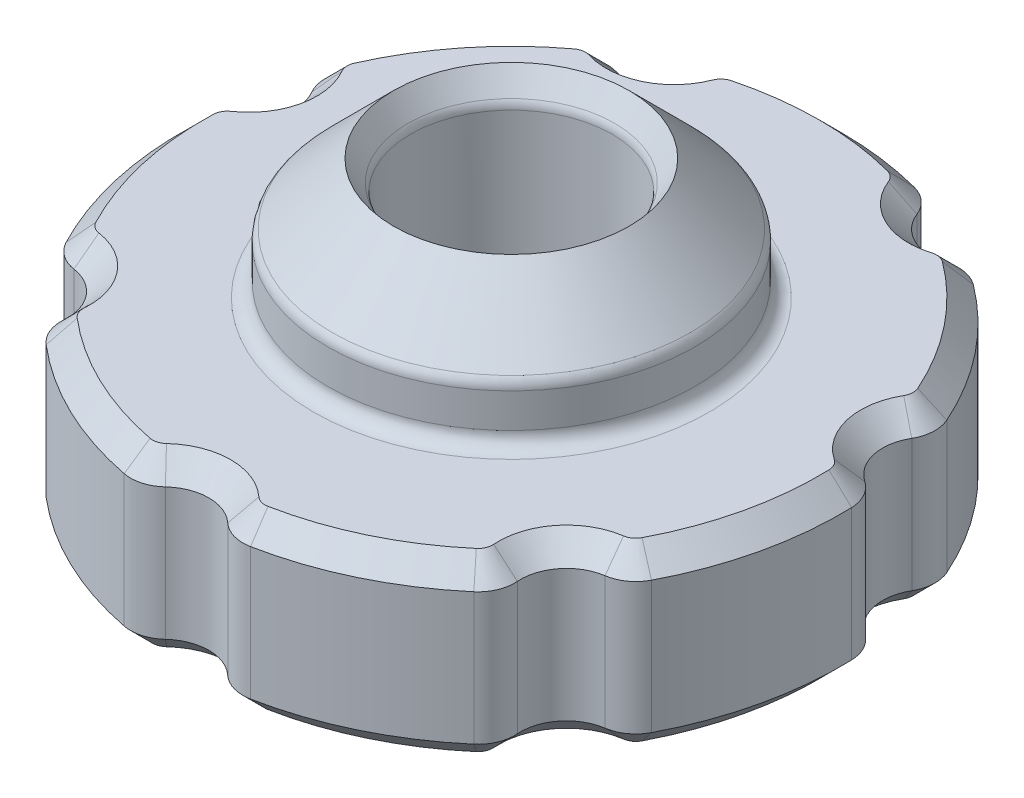
from build123d import *

# Parameters (mm, degrees)
SKETCH1_R           = 9
BOSS_EXTRUDE1_DEPTH = 4.8
SKETCH2_R           = 5
BOSS_EXTRUDE2_DEPTH = 3.5
SKETCH3_R           = 2.75
CUT_EXTRUDE1_DEPTH  = 6.8
CHAMFER1_SIZE       = 2
CHAMFER2_SIZE       = 0.6
CHAMFER2_SIZE_2     = 0.889536581
SKETCH4_R           = 1.25
CUT_EXTRUDE2_DEPTH  = 16.081910128
CIRPATTERN1_COUNT   = 7
FILLET1_R           = 1
SKETCH5_R           = 2
CUT_EXTRUDE3_DEPTH  = 16.081910248
CHAMFER3_SIZE       = 0.6
FILLET2_R           = 0.4


with BuildPart() as part:
    # Sketch1 → Boss-Extrude1 (new body)
    with BuildSketch(Plane(origin=(0, 0, 0), x_dir=(1, 0, 0), z_dir=(0, 1, 0))):
        with Locations(Location((0, 0, 0), (0, 0, 270))):
            Circle(SKETCH1_R)
    extrude(amount=BOSS_EXTRUDE1_DEPTH)

    # Sketch2 → Boss-Extrude2 (add)
    with BuildSketch(Plane(origin=(0, 4.8, 0), x_dir=(1, 0, 0), z_dir=(0, 1, 0))):
        with Locations(Location((0, 0, 0), (0, 0, 270))):
            Circle(SKETCH2_R)
    extrude(amount=BOSS_EXTRUDE2_DEPTH)

    # Sketch3 → Cut-Extrude1 (cut)
    with BuildSketch(Plane(origin=(0, 8.3, 0), x_dir=(1, 0, 0), z_dir=(0, 1, 0))):
        with Locations(Location((0, 0, 0), (0, 0, 270))):
            Circle(SKETCH3_R)
    extrude(amount=-CUT_EXTRUDE1_DEPTH, mode=Mode.SUBTRACT)

    # Chamfer1
    chamfer1_edges = [part.edges().sort_by_distance(p)[0] for p in [
        (0, 8.3, -5),
    ]]
    chamfer(chamfer1_edges, length=CHAMFER1_SIZE)

    # Chamfer2
    # the kernel refuses this chamfer: 0.889536581, 0.6 mm, written as the material it takes off along each edge
    with BuildSketch(Plane(origin=(0, 8.3, 0), x_dir=(0, 0, 1), z_dir=(-1, 0, 0))) as chamfer2_piece_1:
        Polygon((2.75 + CHAMFER2_SIZE, 0), (2.75, -CHAMFER2_SIZE_2), (2.75, 0), align=None)
    revolve(axis=Axis((0, 8.3, 0), (0, 1, 0)), mode=Mode.SUBTRACT)

    # Sketch4 → Cut-Extrude2 (cut, through all)
    with BuildSketch(Plane.XZ):
        with Locations((0, 9.5)):
            Circle(SKETCH4_R)
    cut_extrude2 = extrude(amount=-CUT_EXTRUDE2_DEPTH, mode=Mode.SUBTRACT)

    # CirPattern1: Cut-Extrude2 ×7 about axis
    cirpattern1_axis = Axis((0, 0, 0), (0, 1, 0))
    for i in range(1, CIRPATTERN1_COUNT):
        add(cut_extrude2.rotate(cirpattern1_axis, i * 360 / CIRPATTERN1_COUNT), mode=Mode.SUBTRACT)

    # Fillet1
    fillet1_edges = [part.edges().sort_by_distance(p)[0] for p in [
        (0, 1.5, -2.75),
        (-1.112946158, 2.4, 8.930921053),
        (1.112946158, 2.4, 8.930921053),
        (6.288564667, 2.4, 6.438474543),
        (7.676385826, 2.4, 4.698201853),
        (8.954658034, 2.4, -0.902274619),
        (8.459350397, 2.4, -3.072359168),
        (4.877711261, 2.4, -7.563592589),
        (2.87225158, 2.4, -8.529371071),
        (-2.87225158, 2.4, -8.529371071),
        (-4.877711261, 2.4, -7.563592589),
        (-8.459350397, 2.4, -3.072359168),
        (-8.954658034, 2.4, -0.902274619),
        (-7.676385826, 2.4, 4.698201853),
        (-6.288564667, 2.4, 6.438474543),
    ]]
    fillet(fillet1_edges, radius=FILLET1_R)

    # Sketch5 → Cut-Extrude3 (cut, through all)
    with BuildSketch(Plane.XZ):
        with Locations(Location((0, 0, 0), (0, 0, 270))):
            Circle(SKETCH5_R)
    extrude(amount=-CUT_EXTRUDE3_DEPTH, mode=Mode.SUBTRACT)

    # Chamfer3
    chamfer3_edges = [part.edges().sort_by_distance(p)[0] for p in [
        (-7.674626305, 0, 4.512162546),
        (-6.106798223, 0, 6.478156776),
        (-1.257300502, 0, 8.813551793),
        (1.257300502, 0, 8.813551793),
        (0, 4.8, 8.25),
        (6.45010973, 4.8, 5.143790865),
        (8.77435121, 4.8, 2.002688406),
        (8.043155276, 4.8, -1.835797705),
        (7.036483342, 4.8, -5.611408217),
        (3.579540848, 4.8, -7.43299316),
        (0, 4.8, -9),
        (-3.579540848, 4.8, -7.43299316),
        (-7.036483342, 4.8, -5.611408217),
        (-8.043155276, 4.8, -1.835797705),
        (-8.77435121, 4.8, 2.002688406),
        (-6.45010973, 4.8, 5.143790865),
        (-3.904953652, 4.8, 8.108719811),
        (6.106798223, 4.8, 6.478156776),
        (7.674626305, 4.8, 4.512162546),
        (8.87235333, 4.8, -0.735422423),
        (8.312801966, 4.8, -3.18697713),
        (4.956845417, 4.8, -7.395213538),
        (2.691268197, 4.8, -8.486258024),
        (-2.691268197, 4.8, -8.486258024),
        (-4.956845417, 4.8, -7.395213538),
        (-8.312801966, 4.8, -3.18697713),
        (-8.87235333, 4.8, -0.735422423),
        (-7.674626305, 4.8, 4.512162546),
        (-6.106798223, 4.8, 6.478156776),
        (-1.257300502, 4.8, 8.813551793),
        (1.257300502, 4.8, 8.813551793),
        (0, 0, 2),
        (3.904953652, 0, 8.108719811),
        (3.904953652, 4.8, 8.108719811),
        (8.77435121, 0, 2.002688406),
        (6.45010973, 0, 5.143790865),
        (0, 0, 8.25),
        (-3.904953652, 0, 8.108719811),
        (-6.45010973, 0, 5.143790865),
        (-8.77435121, 0, 2.002688406),
        (-8.043155276, 0, -1.835797705),
        (-7.036483342, 0, -5.611408217),
        (-3.579540848, 0, -7.43299316),
        (0, 0, -9),
        (3.579540848, 0, -7.43299316),
        (7.036483342, 0, -5.611408217),
        (8.043155276, 0, -1.835797705),
        (6.106798223, 0, 6.478156776),
        (7.674626305, 0, 4.512162546),
        (8.87235333, 0, -0.735422423),
        (8.312801966, 0, -3.18697713),
        (4.956845417, 0, -7.395213538),
        (2.691268197, 0, -8.486258024),
        (-2.691268197, 0, -8.486258024),
        (-4.956845417, 0, -7.395213538),
        (-8.312801966, 0, -3.18697713),
        (-8.87235333, 0, -0.735422423),
    ]]
    chamfer(chamfer3_edges, length=CHAMFER3_SIZE)

    # Fillet2
    fillet2_edges = [part.edges().sort_by_distance(p)[0] for p in [
        (0, 6.3, -5),
        (0, 7.410463419, -2.75),
        (0, 4.8, -5),
    ]]
    fillet(fillet2_edges, radius=FILLET2_R)


solid = part.part
